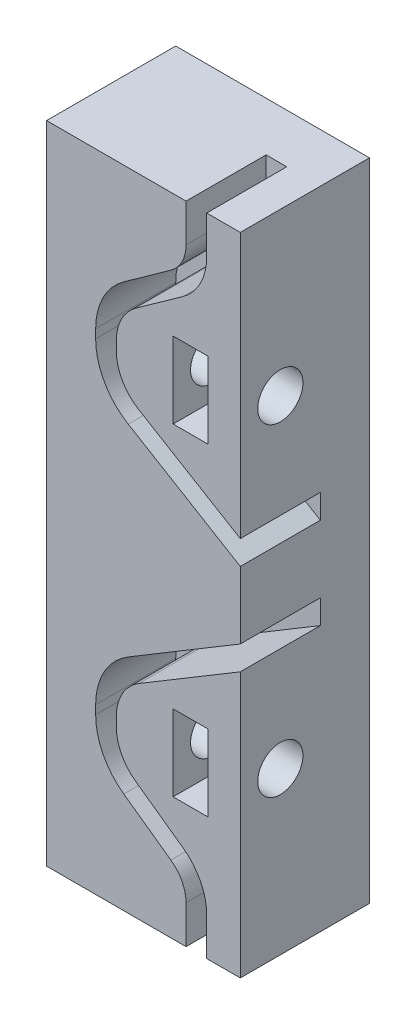
from build123d import *

# Parameters (mm, degrees)
ESQUISSE1_W                           = 15
ESQUISSE1_H                           = 10
BOSS_EXTRU_1_DEPTH                    = 25
ENL_VEMENT_START                      = -6.2
ENL_VEMENT_DE_MATI_RE_BALAYAGE1_DEPTH = 6.2
ENL_V_MAT_EXTRU_1_REACH               = 32.822
ESQUISSE4_R                           = 1.75
ENL_V_MAT_EXTRU_2_REACH               = 32.822
ESQUISSE5_W                           = 2.7
ESQUISSE5_H                           = 5.9


# Read off the part's stored shape, not the designer's step: Enlèvement de matière-Balayage1
with BuildPart() as part:
    # Esquisse1 → Boss.-Extru.1 (new body)
    with BuildSketch(Plane(origin=(0, 0, 0), x_dir=(1, 0, 0), z_dir=(0, 1, 0))):
        with Locations((7.5, 5)):
            Rectangle(ESQUISSE1_W, ESQUISSE1_H)
    extrude(amount=BOSS_EXTRU_1_DEPTH)

    # Enlèvement de matière-Balayage1 outline → Enlèvement de matière-Balayage1 (cut)
    with BuildSketch(Plane.XY.offset(ENL_VEMENT_START)):
        with BuildLine():
            Line((10.8, 25), (10.8, 22.058471581))
            ThreePointArc((10.8, 22.058471581), (10.4896694, 20.777243155), (9.627466942, 19.780017862))
            Line((9.627466942, 19.780017862), (5.977561393, 17.172942469))
            ThreePointArc((5.977561393, 17.172942469), (4.376328258, 15.320952639), (3.8, 12.941528419))
            Line((3.8, 12.941528419), (3.8, 12.264761516))
            ThreePointArc((3.8, 12.264761516), (4.474960485, 9.702727678), (6.324622072, 7.805798302))
            Line((6.324622072, 7.805798302), (15, 2.600571545))
            Line((15, 2.600571545), (15, 4.466476152))
            Line((15, 4.466476152), (7.14781528, 9.177786983))
            ThreePointArc((7.14781528, 9.177786983), (5.867280336, 10.491045782), (5.4, 12.264761516))
            Line((5.4, 12.264761516), (5.4, 12.941528419))
            ThreePointArc((5.4, 12.941528419), (5.798996486, 14.58882211), (6.907542503, 15.870968915))
            Line((6.907542503, 15.870968915), (10.557448052, 18.478044308))
            ThreePointArc((10.557448052, 18.478044308), (11.912337628, 20.045112625), (12.4, 22.058471581))
            Line((12.4, 22.058471581), (12.4, 25))
            Line((12.4, 25), (10.8, 25))
        make_face()
    extrude(amount=ENL_VEMENT_DE_MATI_RE_BALAYAGE1_DEPTH, mode=Mode.SUBTRACT)

    # Esquisse4 → Enlèv. mat.-Extru.1 (cut, up to next)
    with BuildSketch(Plane(origin=(15, 0, 0), x_dir=(0, 0, -1), z_dir=(1, 0, 0)), mode=Mode.PRIVATE) as enl_v_mat_extru_1_sk1:
        with Locations((3.1, 12.5)):
            Circle(ESQUISSE4_R)
    enl_v_mat_extru_1_tool1 = extrude(enl_v_mat_extru_1_sk1.sketch, amount=-ENL_V_MAT_EXTRU_1_REACH, mode=Mode.PRIVATE) & part.part
    add(enl_v_mat_extru_1_tool1.solids().sort_by_distance((15, 12.5, -3.1))[0], mode=Mode.SUBTRACT)

    # Esquisse5 → Enlèv. mat.-Extru.2 (cut, up to next)
    with BuildSketch(Plane.XY, mode=Mode.PRIVATE) as enl_v_mat_extru_2_sk1:
        with Locations((11.15, 12.5)):
            Rectangle(ESQUISSE5_W, ESQUISSE5_H)
    enl_v_mat_extru_2_tool1 = extrude(enl_v_mat_extru_2_sk1.sketch, amount=-ENL_V_MAT_EXTRU_2_REACH, mode=Mode.PRIVATE) & part.part
    add(enl_v_mat_extru_2_tool1.solids().sort_by_distance((11.15, 12.5, 0))[0], mode=Mode.SUBTRACT)

    # Symétrie1: part across plane


with BuildPart() as part_1:
    add(part.part)
    add(part.part.mirror(Plane(origin=(0, 0, 0), x_dir=(0, 0, 1), z_dir=(0, -1, 0))))


solid = part_1.part
